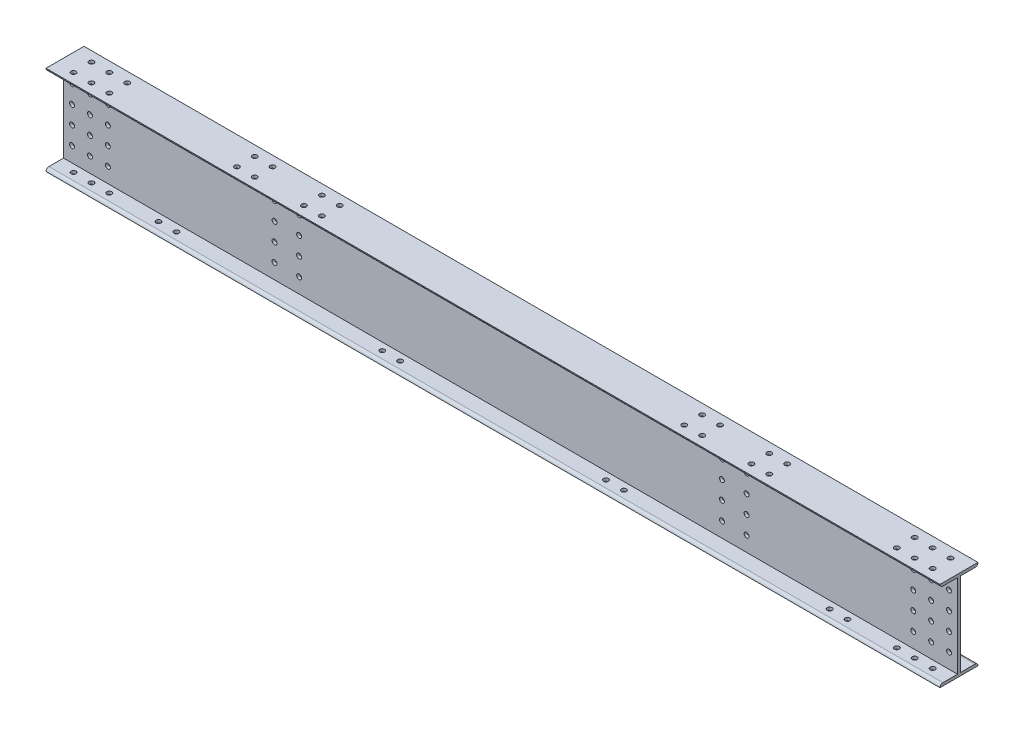
from build123d import *

# Parameters (mm, degrees)
SKETCH_1_W                         = 3996
SKETCH_1_H                         = 400
EXTRUDE_1_DEPTH                    = 170
SKETCH_2_R                         = 11
CUT_EXTRUDE_1_DEPTH                = 4020.566643309
PATTERN_LINEAR_1_COUNT             = 4
PATTERN_LINEAR_1_PITCH             = 80
PATTERN_LINEAR_8_COUNT             = 2
PATTERN_LINEAR_8_PITCH             = 80
PATTERN_LINEAR_8_COPY_1_SKETCH_R   = 11
PATTERN_LINEAR_8_COPY_1_DEPTH      = 4020.566643309
PATTERN_LINEAR_8_COPY_2_SKETCH_R   = 11
PATTERN_LINEAR_8_COPY_2_DEPTH      = 4020.566643309
PATTERN_LINEAR_8_COPY_3_SKETCH_R   = 11
PATTERN_LINEAR_8_COPY_3_DEPTH      = 4020.566643309
PATTERN_LINEAR_9_COUNT             = 2
PATTERN_LINEAR_9_PITCH             = 160
PATTERN_LINEAR_9_COPY_1_SKETCH_R   = 11
PATTERN_LINEAR_9_COPY_1_DEPTH      = 4020.566643309
PATTERN_LINEAR_9_COPY_2_SKETCH_R   = 11
PATTERN_LINEAR_9_COPY_2_DEPTH      = 4020.566643309
PATTERN_LINEAR_9_COPY_3_SKETCH_R   = 11
PATTERN_LINEAR_9_COPY_3_DEPTH      = 4020.566643309
PATTERN_LINEAR_11_COUNT            = 2
PATTERN_LINEAR_11_PITCH            = 3760
PATTERN_LINEAR_11_COPY_1_SKETCH_R  = 11
PATTERN_LINEAR_11_COPY_1_DEPTH     = 4020.566643309
PATTERN_LINEAR_11_COPY_2_SKETCH_R  = 11
PATTERN_LINEAR_11_COPY_2_DEPTH     = 4020.566643309
PATTERN_LINEAR_11_COPY_3_SKETCH_R  = 11
PATTERN_LINEAR_11_COPY_3_DEPTH     = 4020.566643309
PATTERN_LINEAR_11_COPY_4_SKETCH_R  = 11
PATTERN_LINEAR_11_COPY_4_DEPTH     = 4020.566643309
PATTERN_LINEAR_11_COPY_5_SKETCH_R  = 11
PATTERN_LINEAR_11_COPY_5_DEPTH     = 4020.566643309
PATTERN_LINEAR_11_COPY_6_SKETCH_R  = 11
PATTERN_LINEAR_11_COPY_6_DEPTH     = 4020.566643309
PATTERN_LINEAR_11_COPY_7_SKETCH_R  = 11
PATTERN_LINEAR_11_COPY_7_DEPTH     = 4020.566643309
PATTERN_LINEAR_11_COPY_8_SKETCH_R  = 11
PATTERN_LINEAR_11_COPY_8_DEPTH     = 4020.566643309
PATTERN_LINEAR_11_COPY_9_SKETCH_R  = 11
PATTERN_LINEAR_11_COPY_9_DEPTH     = 4020.566643309
PATTERN_LINEAR_11_COPY_10_SKETCH_R = 11
PATTERN_LINEAR_11_COPY_10_DEPTH    = 4020.566643309
PATTERN_LINEAR_11_COPY_11_SKETCH_R = 11
PATTERN_LINEAR_11_COPY_11_DEPTH    = 4020.566643309
PATTERN_LINEAR_12_COUNT            = 2
PATTERN_LINEAR_12_PITCH            = 905
PATTERN_LINEAR_12_COPY_1_SKETCH_R  = 11
PATTERN_LINEAR_12_COPY_1_DEPTH     = 4020.566643309
PATTERN_LINEAR_12_COPY_2_SKETCH_R  = 11
PATTERN_LINEAR_12_COPY_2_DEPTH     = 4020.566643309
PATTERN_LINEAR_12_COPY_3_SKETCH_R  = 11
PATTERN_LINEAR_12_COPY_3_DEPTH     = 4020.566643309
PATTERN_LINEAR_13_COUNT            = 2
PATTERN_LINEAR_13_PITCH            = 1015
PATTERN_LINEAR_13_COPY_1_SKETCH_R  = 11
PATTERN_LINEAR_13_COPY_1_DEPTH     = 4020.566643309
PATTERN_LINEAR_13_COPY_2_SKETCH_R  = 11
PATTERN_LINEAR_13_COPY_2_DEPTH     = 4020.566643309
PATTERN_LINEAR_13_COPY_3_SKETCH_R  = 11
PATTERN_LINEAR_13_COPY_3_DEPTH     = 4020.566643309
PATTERN_LINEAR_15_COUNT            = 2
PATTERN_LINEAR_15_PITCH            = 3015
PATTERN_LINEAR_15_COPY_1_SKETCH_R  = 11
PATTERN_LINEAR_15_COPY_1_DEPTH     = 4020.566643309
PATTERN_LINEAR_15_COPY_2_SKETCH_R  = 11
PATTERN_LINEAR_15_COPY_2_DEPTH     = 4020.566643309
PATTERN_LINEAR_15_COPY_3_SKETCH_R  = 11
PATTERN_LINEAR_15_COPY_3_DEPTH     = 4020.566643309
PATTERN_LINEAR_17_COUNT            = 2
PATTERN_LINEAR_17_PITCH            = 2905
PATTERN_LINEAR_17_COPY_1_SKETCH_R  = 11
PATTERN_LINEAR_17_COPY_1_DEPTH     = 4020.566643309
PATTERN_LINEAR_17_COPY_2_SKETCH_R  = 11
PATTERN_LINEAR_17_COPY_2_DEPTH     = 4020.566643309
PATTERN_LINEAR_17_COPY_3_SKETCH_R  = 11
PATTERN_LINEAR_17_COPY_3_DEPTH     = 4020.566643309
SKETCH_3_R                         = 11
CUT_EXTRUDE_2_DEPTH                = 120
PATTERN_LINEAR_18_COUNT            = 2
PATTERN_LINEAR_18_PITCH            = 80
PATTERN_LINEAR_19_COUNT            = 3
PATTERN_LINEAR_19_PITCH            = 80
PATTERN_LINEAR_19_COPY_1_SKETCH_R  = 11
PATTERN_LINEAR_19_COPY_1_DEPTH     = 120
PATTERN_LINEAR_19_COPY_2_SKETCH_R  = 11
PATTERN_LINEAR_19_COPY_2_DEPTH     = 120
PATTERN_LINEAR_20_COUNT            = 2
PATTERN_LINEAR_20_PITCH            = 3680
PATTERN_LINEAR_20_COPY_1_SKETCH_R  = 11
PATTERN_LINEAR_20_COPY_1_DEPTH     = 120
PATTERN_LINEAR_20_COPY_2_SKETCH_R  = 11
PATTERN_LINEAR_20_COPY_2_DEPTH     = 120
PATTERN_LINEAR_20_COPY_3_SKETCH_R  = 11
PATTERN_LINEAR_20_COPY_3_DEPTH     = 120
PATTERN_LINEAR_20_COPY_4_SKETCH_R  = 11
PATTERN_LINEAR_20_COPY_4_DEPTH     = 120
PATTERN_LINEAR_20_COPY_5_SKETCH_R  = 11
PATTERN_LINEAR_20_COPY_5_DEPTH     = 120
PATTERN_LINEAR_21_COUNT            = 2
PATTERN_LINEAR_21_PITCH            = 730
PATTERN_LINEAR_21_COPY_1_SKETCH_R  = 11
PATTERN_LINEAR_21_COPY_1_DEPTH     = 120
PATTERN_LINEAR_22_COUNT            = 2
PATTERN_LINEAR_22_PITCH            = 810
PATTERN_LINEAR_22_COPY_1_SKETCH_R  = 11
PATTERN_LINEAR_22_COPY_1_DEPTH     = 120
PATTERN_LINEAR_24_COUNT            = 2
PATTERN_LINEAR_24_PITCH            = 1030
PATTERN_LINEAR_24_COPY_1_SKETCH_R  = 11
PATTERN_LINEAR_24_COPY_1_DEPTH     = 120
PATTERN_LINEAR_25_COUNT            = 2
PATTERN_LINEAR_25_PITCH            = 1110
PATTERN_LINEAR_25_COPY_1_SKETCH_R  = 11
PATTERN_LINEAR_25_COPY_1_DEPTH     = 120
PATTERN_LINEAR_26_COUNT            = 2
PATTERN_LINEAR_26_PITCH            = 3110
PATTERN_LINEAR_26_COPY_1_SKETCH_R  = 11
PATTERN_LINEAR_26_COPY_1_DEPTH     = 120
PATTERN_LINEAR_27_COUNT            = 2
PATTERN_LINEAR_27_PITCH            = 3030
PATTERN_LINEAR_27_COPY_1_SKETCH_R  = 11
PATTERN_LINEAR_27_COPY_1_DEPTH     = 120
PATTERN_LINEAR_28_COUNT            = 2
PATTERN_LINEAR_28_PITCH            = 2810
PATTERN_LINEAR_28_COPY_1_SKETCH_R  = 11
PATTERN_LINEAR_28_COPY_1_DEPTH     = 120
PATTERN_LINEAR_29_COUNT            = 2
PATTERN_LINEAR_29_PITCH            = 2730
PATTERN_LINEAR_29_COPY_1_SKETCH_R  = 11
PATTERN_LINEAR_29_COPY_1_DEPTH     = 120
CUT_EXTRUDE_START                  = -120
SKETCH_4_R                         = 11
CUT_EXTRUDE_3_DEPTH                = 120
PATTERN_LINEAR_39_COUNT            = 2
PATTERN_LINEAR_39_PITCH            = 80
PATTERN_LINEAR_40_COUNT            = 2
PATTERN_LINEAR_40_PITCH            = 80
PATTERN_START                      = -120
PATTERN_LINEAR_40_COPY_1_SKETCH_R  = 11
PATTERN_LINEAR_40_COPY_1_DEPTH     = 120
PATTERN_LINEAR_41_COUNT            = 2
PATTERN_LINEAR_41_PITCH            = 160
PATTERN_LINEAR_41_COPY_1_SKETCH_R  = 11
PATTERN_LINEAR_41_COPY_1_DEPTH     = 120
PATTERN_LINEAR_43_COUNT            = 2
PATTERN_LINEAR_43_PITCH            = 1380
PATTERN_LINEAR_43_COPY_1_SKETCH_R  = 11
PATTERN_LINEAR_43_COPY_1_DEPTH     = 120
PATTERN_LINEAR_43_COPY_2_SKETCH_R  = 11
PATTERN_LINEAR_43_COPY_2_DEPTH     = 120
PATTERN_LINEAR_43_COPY_3_SKETCH_R  = 11
PATTERN_LINEAR_43_COPY_3_DEPTH     = 120
PATTERN_LINEAR_44_COUNT            = 2
PATTERN_LINEAR_44_PITCH            = 380
PATTERN_LINEAR_44_COPY_1_SKETCH_R  = 11
PATTERN_LINEAR_44_COPY_1_DEPTH     = 120
PATTERN_LINEAR_44_COPY_2_SKETCH_R  = 11
PATTERN_LINEAR_44_COPY_2_DEPTH     = 120
PATTERN_LINEAR_44_COPY_3_SKETCH_R  = 11
PATTERN_LINEAR_44_COPY_3_DEPTH     = 120
PATTERN_LINEAR_46_COUNT            = 2
PATTERN_LINEAR_46_PITCH            = 2380
PATTERN_LINEAR_46_COPY_1_SKETCH_R  = 11
PATTERN_LINEAR_46_COPY_1_DEPTH     = 120
PATTERN_LINEAR_46_COPY_2_SKETCH_R  = 11
PATTERN_LINEAR_46_COPY_2_DEPTH     = 120
PATTERN_LINEAR_46_COPY_3_SKETCH_R  = 11
PATTERN_LINEAR_46_COPY_3_DEPTH     = 120
PATTERN_LINEAR_47_COUNT            = 2
PATTERN_LINEAR_47_PITCH            = 3380
PATTERN_LINEAR_47_COPY_1_SKETCH_R  = 11
PATTERN_LINEAR_47_COPY_1_DEPTH     = 120
PATTERN_LINEAR_47_COPY_2_SKETCH_R  = 11
PATTERN_LINEAR_47_COPY_2_DEPTH     = 120
PATTERN_LINEAR_47_COPY_3_SKETCH_R  = 11
PATTERN_LINEAR_47_COPY_3_DEPTH     = 120
PATTERN_LINEAR_48_COUNT            = 2
PATTERN_LINEAR_48_PITCH            = 3680
PATTERN_LINEAR_48_COPY_1_SKETCH_R  = 11
PATTERN_LINEAR_48_COPY_1_DEPTH     = 120
PATTERN_LINEAR_48_COPY_2_SKETCH_R  = 11
PATTERN_LINEAR_48_COPY_2_DEPTH     = 120
PATTERN_LINEAR_48_COPY_3_SKETCH_R  = 11
PATTERN_LINEAR_48_COPY_3_DEPTH     = 120
PATTERN_LINEAR_48_COPY_4_SKETCH_R  = 11
PATTERN_LINEAR_48_COPY_4_DEPTH     = 120
PATTERN_LINEAR_48_COPY_5_SKETCH_R  = 11
PATTERN_LINEAR_48_COPY_5_DEPTH     = 120
SKETCH_6_W                         = 78.5
SKETCH_6_H                         = 374
CUT_EXTRUDE_4_DEPTH                = 4020.566643309
FILLET_1_R                         = 13
FILLET_2_R                         = 13
FILLET_3_R                         = 13
FILLET_4_R                         = 13


with BuildPart() as part:
    # 草图1 → 拉伸1 (new body)
    with BuildSketch(Plane.XY):
        with Locations((1998, 200)):
            Rectangle(SKETCH_1_W, SKETCH_1_H)
    extrude(amount=EXTRUDE_1_DEPTH)

    # 草图2 → 切除-拉伸1 (cut, through all)
    with BuildSketch(Plane.XY.offset(170)):
        with Locations((38, 80)):
            Circle(SKETCH_2_R)
    cut_extrude_1 = extrude(amount=-CUT_EXTRUDE_1_DEPTH, mode=Mode.SUBTRACT)

    # 阵列(线性)1: 切除-拉伸1 ×4
    with Locations(*[(0, i * PATTERN_LINEAR_1_PITCH, 0) for i in range(1, PATTERN_LINEAR_1_COUNT)]):
        add(cut_extrude_1, mode=Mode.SUBTRACT)

    # 阵列(线性)8: 切除-拉伸1 ×2
    with Locations(*[(i * PATTERN_LINEAR_8_PITCH, 0, 0) for i in range(1, PATTERN_LINEAR_8_COUNT)]):
        add(cut_extrude_1, mode=Mode.SUBTRACT)

    # 阵列(线性)8 copy 1 sketch → 阵列(线性)8 copy 1 (cut, through all)
    with BuildSketch(Plane(origin=(80, 80, 170), x_dir=(1, 0, 0), z_dir=(0, 0, 1))):
        with Locations((38, 80)):
            Circle(PATTERN_LINEAR_8_COPY_1_SKETCH_R)
    extrude(amount=-PATTERN_LINEAR_8_COPY_1_DEPTH, mode=Mode.SUBTRACT)

    # 阵列(线性)8 copy 2 sketch → 阵列(线性)8 copy 2 (cut, through all)
    with BuildSketch(Plane(origin=(80, 160, 170), x_dir=(1, 0, 0), z_dir=(0, 0, 1))):
        with Locations((38, 80)):
            Circle(PATTERN_LINEAR_8_COPY_2_SKETCH_R)
    extrude(amount=-PATTERN_LINEAR_8_COPY_2_DEPTH, mode=Mode.SUBTRACT)

    # 阵列(线性)8 copy 3 sketch → 阵列(线性)8 copy 3 (cut, through all)
    with BuildSketch(Plane(origin=(80, 240, 170), x_dir=(1, 0, 0), z_dir=(0, 0, 1))):
        with Locations((38, 80)):
            Circle(PATTERN_LINEAR_8_COPY_3_SKETCH_R)
    extrude(amount=-PATTERN_LINEAR_8_COPY_3_DEPTH, mode=Mode.SUBTRACT)

    # 阵列(线性)9: 切除-拉伸1 ×2
    with Locations(*[(i * PATTERN_LINEAR_9_PITCH, 0, 0) for i in range(1, PATTERN_LINEAR_9_COUNT)]):
        add(cut_extrude_1, mode=Mode.SUBTRACT)

    # 阵列(线性)9 copy 1 sketch → 阵列(线性)9 copy 1 (cut, through all)
    with BuildSketch(Plane(origin=(160, 80, 170), x_dir=(1, 0, 0), z_dir=(0, 0, 1))):
        with Locations((38, 80)):
            Circle(PATTERN_LINEAR_9_COPY_1_SKETCH_R)
    extrude(amount=-PATTERN_LINEAR_9_COPY_1_DEPTH, mode=Mode.SUBTRACT)

    # 阵列(线性)9 copy 2 sketch → 阵列(线性)9 copy 2 (cut, through all)
    with BuildSketch(Plane(origin=(160, 160, 170), x_dir=(1, 0, 0), z_dir=(0, 0, 1))):
        with Locations((38, 80)):
            Circle(PATTERN_LINEAR_9_COPY_2_SKETCH_R)
    extrude(amount=-PATTERN_LINEAR_9_COPY_2_DEPTH, mode=Mode.SUBTRACT)

    # 阵列(线性)9 copy 3 sketch → 阵列(线性)9 copy 3 (cut, through all)
    with BuildSketch(Plane(origin=(160, 240, 170), x_dir=(1, 0, 0), z_dir=(0, 0, 1))):
        with Locations((38, 80)):
            Circle(PATTERN_LINEAR_9_COPY_3_SKETCH_R)
    extrude(amount=-PATTERN_LINEAR_9_COPY_3_DEPTH, mode=Mode.SUBTRACT)

    # 阵列(线性)11: 切除-拉伸1 ×2
    with Locations(*[(i * PATTERN_LINEAR_11_PITCH, 0, 0) for i in range(1, PATTERN_LINEAR_11_COUNT)]):
        add(cut_extrude_1, mode=Mode.SUBTRACT)

    # 阵列(线性)11 copy 1 sketch → 阵列(线性)11 copy 1 (cut, through all)
    with BuildSketch(Plane(origin=(3760, 80, 170), x_dir=(1, 0, 0), z_dir=(0, 0, 1))):
        with Locations((38, 80)):
            Circle(PATTERN_LINEAR_11_COPY_1_SKETCH_R)
    extrude(amount=-PATTERN_LINEAR_11_COPY_1_DEPTH, mode=Mode.SUBTRACT)

    # 阵列(线性)11 copy 2 sketch → 阵列(线性)11 copy 2 (cut, through all)
    with BuildSketch(Plane(origin=(3760, 160, 170), x_dir=(1, 0, 0), z_dir=(0, 0, 1))):
        with Locations((38, 80)):
            Circle(PATTERN_LINEAR_11_COPY_2_SKETCH_R)
    extrude(amount=-PATTERN_LINEAR_11_COPY_2_DEPTH, mode=Mode.SUBTRACT)

    # 阵列(线性)11 copy 3 sketch → 阵列(线性)11 copy 3 (cut, through all)
    with BuildSketch(Plane(origin=(3760, 240, 170), x_dir=(1, 0, 0), z_dir=(0, 0, 1))):
        with Locations((38, 80)):
            Circle(PATTERN_LINEAR_11_COPY_3_SKETCH_R)
    extrude(amount=-PATTERN_LINEAR_11_COPY_3_DEPTH, mode=Mode.SUBTRACT)

    # 阵列(线性)11 copy 4 sketch → 阵列(线性)11 copy 4 (cut, through all)
    with BuildSketch(Plane(origin=(3840, 0, 170), x_dir=(1, 0, 0), z_dir=(0, 0, 1))):
        with Locations((38, 80)):
            Circle(PATTERN_LINEAR_11_COPY_4_SKETCH_R)
    extrude(amount=-PATTERN_LINEAR_11_COPY_4_DEPTH, mode=Mode.SUBTRACT)

    # 阵列(线性)11 copy 5 sketch → 阵列(线性)11 copy 5 (cut, through all)
    with BuildSketch(Plane(origin=(3840, 80, 170), x_dir=(1, 0, 0), z_dir=(0, 0, 1))):
        with Locations((38, 80)):
            Circle(PATTERN_LINEAR_11_COPY_5_SKETCH_R)
    extrude(amount=-PATTERN_LINEAR_11_COPY_5_DEPTH, mode=Mode.SUBTRACT)

    # 阵列(线性)11 copy 6 sketch → 阵列(线性)11 copy 6 (cut, through all)
    with BuildSketch(Plane(origin=(3840, 160, 170), x_dir=(1, 0, 0), z_dir=(0, 0, 1))):
        with Locations((38, 80)):
            Circle(PATTERN_LINEAR_11_COPY_6_SKETCH_R)
    extrude(amount=-PATTERN_LINEAR_11_COPY_6_DEPTH, mode=Mode.SUBTRACT)

    # 阵列(线性)11 copy 7 sketch → 阵列(线性)11 copy 7 (cut, through all)
    with BuildSketch(Plane(origin=(3840, 240, 170), x_dir=(1, 0, 0), z_dir=(0, 0, 1))):
        with Locations((38, 80)):
            Circle(PATTERN_LINEAR_11_COPY_7_SKETCH_R)
    extrude(amount=-PATTERN_LINEAR_11_COPY_7_DEPTH, mode=Mode.SUBTRACT)

    # 阵列(线性)11 copy 8 sketch → 阵列(线性)11 copy 8 (cut, through all)
    with BuildSketch(Plane(origin=(3920, 0, 170), x_dir=(1, 0, 0), z_dir=(0, 0, 1))):
        with Locations((38, 80)):
            Circle(PATTERN_LINEAR_11_COPY_8_SKETCH_R)
    extrude(amount=-PATTERN_LINEAR_11_COPY_8_DEPTH, mode=Mode.SUBTRACT)

    # 阵列(线性)11 copy 9 sketch → 阵列(线性)11 copy 9 (cut, through all)
    with BuildSketch(Plane(origin=(3920, 80, 170), x_dir=(1, 0, 0), z_dir=(0, 0, 1))):
        with Locations((38, 80)):
            Circle(PATTERN_LINEAR_11_COPY_9_SKETCH_R)
    extrude(amount=-PATTERN_LINEAR_11_COPY_9_DEPTH, mode=Mode.SUBTRACT)

    # 阵列(线性)11 copy 10 sketch → 阵列(线性)11 copy 10 (cut, through all)
    with BuildSketch(Plane(origin=(3920, 160, 170), x_dir=(1, 0, 0), z_dir=(0, 0, 1))):
        with Locations((38, 80)):
            Circle(PATTERN_LINEAR_11_COPY_10_SKETCH_R)
    extrude(amount=-PATTERN_LINEAR_11_COPY_10_DEPTH, mode=Mode.SUBTRACT)

    # 阵列(线性)11 copy 11 sketch → 阵列(线性)11 copy 11 (cut, through all)
    with BuildSketch(Plane(origin=(3920, 240, 170), x_dir=(1, 0, 0), z_dir=(0, 0, 1))):
        with Locations((38, 80)):
            Circle(PATTERN_LINEAR_11_COPY_11_SKETCH_R)
    extrude(amount=-PATTERN_LINEAR_11_COPY_11_DEPTH, mode=Mode.SUBTRACT)

    # 阵列(线性)12: 切除-拉伸1 ×2
    with Locations(*[(i * PATTERN_LINEAR_12_PITCH, 0, 0) for i in range(1, PATTERN_LINEAR_12_COUNT)]):
        add(cut_extrude_1, mode=Mode.SUBTRACT)

    # 阵列(线性)12 copy 1 sketch → 阵列(线性)12 copy 1 (cut, through all)
    with BuildSketch(Plane(origin=(905, 80, 170), x_dir=(1, 0, 0), z_dir=(0, 0, 1))):
        with Locations((38, 80)):
            Circle(PATTERN_LINEAR_12_COPY_1_SKETCH_R)
    extrude(amount=-PATTERN_LINEAR_12_COPY_1_DEPTH, mode=Mode.SUBTRACT)

    # 阵列(线性)12 copy 2 sketch → 阵列(线性)12 copy 2 (cut, through all)
    with BuildSketch(Plane(origin=(905, 160, 170), x_dir=(1, 0, 0), z_dir=(0, 0, 1))):
        with Locations((38, 80)):
            Circle(PATTERN_LINEAR_12_COPY_2_SKETCH_R)
    extrude(amount=-PATTERN_LINEAR_12_COPY_2_DEPTH, mode=Mode.SUBTRACT)

    # 阵列(线性)12 copy 3 sketch → 阵列(线性)12 copy 3 (cut, through all)
    with BuildSketch(Plane(origin=(905, 240, 170), x_dir=(1, 0, 0), z_dir=(0, 0, 1))):
        with Locations((38, 80)):
            Circle(PATTERN_LINEAR_12_COPY_3_SKETCH_R)
    extrude(amount=-PATTERN_LINEAR_12_COPY_3_DEPTH, mode=Mode.SUBTRACT)

    # 阵列(线性)13: 切除-拉伸1 ×2
    with Locations(*[(i * PATTERN_LINEAR_13_PITCH, 0, 0) for i in range(1, PATTERN_LINEAR_13_COUNT)]):
        add(cut_extrude_1, mode=Mode.SUBTRACT)

    # 阵列(线性)13 copy 1 sketch → 阵列(线性)13 copy 1 (cut, through all)
    with BuildSketch(Plane(origin=(1015, 80, 170), x_dir=(1, 0, 0), z_dir=(0, 0, 1))):
        with Locations((38, 80)):
            Circle(PATTERN_LINEAR_13_COPY_1_SKETCH_R)
    extrude(amount=-PATTERN_LINEAR_13_COPY_1_DEPTH, mode=Mode.SUBTRACT)

    # 阵列(线性)13 copy 2 sketch → 阵列(线性)13 copy 2 (cut, through all)
    with BuildSketch(Plane(origin=(1015, 160, 170), x_dir=(1, 0, 0), z_dir=(0, 0, 1))):
        with Locations((38, 80)):
            Circle(PATTERN_LINEAR_13_COPY_2_SKETCH_R)
    extrude(amount=-PATTERN_LINEAR_13_COPY_2_DEPTH, mode=Mode.SUBTRACT)

    # 阵列(线性)13 copy 3 sketch → 阵列(线性)13 copy 3 (cut, through all)
    with BuildSketch(Plane(origin=(1015, 240, 170), x_dir=(1, 0, 0), z_dir=(0, 0, 1))):
        with Locations((38, 80)):
            Circle(PATTERN_LINEAR_13_COPY_3_SKETCH_R)
    extrude(amount=-PATTERN_LINEAR_13_COPY_3_DEPTH, mode=Mode.SUBTRACT)

    # 阵列(线性)15: 切除-拉伸1 ×2
    with Locations(*[(i * PATTERN_LINEAR_15_PITCH, 0, 0) for i in range(1, PATTERN_LINEAR_15_COUNT)]):
        add(cut_extrude_1, mode=Mode.SUBTRACT)

    # 阵列(线性)15 copy 1 sketch → 阵列(线性)15 copy 1 (cut, through all)
    with BuildSketch(Plane(origin=(3015, 80, 170), x_dir=(1, 0, 0), z_dir=(0, 0, 1))):
        with Locations((38, 80)):
            Circle(PATTERN_LINEAR_15_COPY_1_SKETCH_R)
    extrude(amount=-PATTERN_LINEAR_15_COPY_1_DEPTH, mode=Mode.SUBTRACT)

    # 阵列(线性)15 copy 2 sketch → 阵列(线性)15 copy 2 (cut, through all)
    with BuildSketch(Plane(origin=(3015, 160, 170), x_dir=(1, 0, 0), z_dir=(0, 0, 1))):
        with Locations((38, 80)):
            Circle(PATTERN_LINEAR_15_COPY_2_SKETCH_R)
    extrude(amount=-PATTERN_LINEAR_15_COPY_2_DEPTH, mode=Mode.SUBTRACT)

    # 阵列(线性)15 copy 3 sketch → 阵列(线性)15 copy 3 (cut, through all)
    with BuildSketch(Plane(origin=(3015, 240, 170), x_dir=(1, 0, 0), z_dir=(0, 0, 1))):
        with Locations((38, 80)):
            Circle(PATTERN_LINEAR_15_COPY_3_SKETCH_R)
    extrude(amount=-PATTERN_LINEAR_15_COPY_3_DEPTH, mode=Mode.SUBTRACT)

    # 阵列(线性)17: 切除-拉伸1 ×2
    with Locations(*[(i * PATTERN_LINEAR_17_PITCH, 0, 0) for i in range(1, PATTERN_LINEAR_17_COUNT)]):
        add(cut_extrude_1, mode=Mode.SUBTRACT)

    # 阵列(线性)17 copy 1 sketch → 阵列(线性)17 copy 1 (cut, through all)
    with BuildSketch(Plane(origin=(2905, 80, 170), x_dir=(1, 0, 0), z_dir=(0, 0, 1))):
        with Locations((38, 80)):
            Circle(PATTERN_LINEAR_17_COPY_1_SKETCH_R)
    extrude(amount=-PATTERN_LINEAR_17_COPY_1_DEPTH, mode=Mode.SUBTRACT)

    # 阵列(线性)17 copy 2 sketch → 阵列(线性)17 copy 2 (cut, through all)
    with BuildSketch(Plane(origin=(2905, 160, 170), x_dir=(1, 0, 0), z_dir=(0, 0, 1))):
        with Locations((38, 80)):
            Circle(PATTERN_LINEAR_17_COPY_2_SKETCH_R)
    extrude(amount=-PATTERN_LINEAR_17_COPY_2_DEPTH, mode=Mode.SUBTRACT)

    # 阵列(线性)17 copy 3 sketch → 阵列(线性)17 copy 3 (cut, through all)
    with BuildSketch(Plane(origin=(2905, 240, 170), x_dir=(1, 0, 0), z_dir=(0, 0, 1))):
        with Locations((38, 80)):
            Circle(PATTERN_LINEAR_17_COPY_3_SKETCH_R)
    extrude(amount=-PATTERN_LINEAR_17_COPY_3_DEPTH, mode=Mode.SUBTRACT)

    # 草图3 → 切除-拉伸2 (cut)
    with BuildSketch(Plane(origin=(0, 400, 0), x_dir=(1, 0, 0), z_dir=(0, 1, 0))):
        with Locations(Location((78, -125, 0), (0, 0, 270))):
            Circle(SKETCH_3_R)
    cut_extrude_2 = extrude(amount=-CUT_EXTRUDE_2_DEPTH, mode=Mode.SUBTRACT)

    # 阵列(线性)18: 切除-拉伸2 ×2
    with Locations(*[(0, 0, -i * PATTERN_LINEAR_18_PITCH) for i in range(1, PATTERN_LINEAR_18_COUNT)]):
        add(cut_extrude_2, mode=Mode.SUBTRACT)

    # 阵列(线性)19: 切除-拉伸2 ×3
    with Locations(*[(i * PATTERN_LINEAR_19_PITCH, 0, 0) for i in range(1, PATTERN_LINEAR_19_COUNT)]):
        add(cut_extrude_2, mode=Mode.SUBTRACT)

    # 阵列(线性)19 copy 1 sketch → 阵列(线性)19 copy 1 (cut)
    with BuildSketch(Plane(origin=(80, 400, -80), x_dir=(1, 0, 0), z_dir=(0, 1, 0))):
        with Locations(Location((78, -125, 0), (0, 0, 270))):
            Circle(PATTERN_LINEAR_19_COPY_1_SKETCH_R)
    extrude(amount=-PATTERN_LINEAR_19_COPY_1_DEPTH, mode=Mode.SUBTRACT)

    # 阵列(线性)19 copy 2 sketch → 阵列(线性)19 copy 2 (cut)
    with BuildSketch(Plane(origin=(160, 400, -80), x_dir=(1, 0, 0), z_dir=(0, 1, 0))):
        with Locations(Location((78, -125, 0), (0, 0, 270))):
            Circle(PATTERN_LINEAR_19_COPY_2_SKETCH_R)
    extrude(amount=-PATTERN_LINEAR_19_COPY_2_DEPTH, mode=Mode.SUBTRACT)

    # 阵列(线性)20: 切除-拉伸2 ×2
    with Locations(*[(i * PATTERN_LINEAR_20_PITCH, 0, 0) for i in range(1, PATTERN_LINEAR_20_COUNT)]):
        add(cut_extrude_2, mode=Mode.SUBTRACT)

    # 阵列(线性)20 copy 1 sketch → 阵列(线性)20 copy 1 (cut)
    with BuildSketch(Plane(origin=(3680, 400, -80), x_dir=(1, 0, 0), z_dir=(0, 1, 0))):
        with Locations(Location((78, -125, 0), (0, 0, 270))):
            Circle(PATTERN_LINEAR_20_COPY_1_SKETCH_R)
    extrude(amount=-PATTERN_LINEAR_20_COPY_1_DEPTH, mode=Mode.SUBTRACT)

    # 阵列(线性)20 copy 2 sketch → 阵列(线性)20 copy 2 (cut)
    with BuildSketch(Plane(origin=(3760, 400, 0), x_dir=(1, 0, 0), z_dir=(0, 1, 0))):
        with Locations(Location((78, -125, 0), (0, 0, 270))):
            Circle(PATTERN_LINEAR_20_COPY_2_SKETCH_R)
    extrude(amount=-PATTERN_LINEAR_20_COPY_2_DEPTH, mode=Mode.SUBTRACT)

    # 阵列(线性)20 copy 3 sketch → 阵列(线性)20 copy 3 (cut)
    with BuildSketch(Plane(origin=(3840, 400, 0), x_dir=(1, 0, 0), z_dir=(0, 1, 0))):
        with Locations(Location((78, -125, 0), (0, 0, 270))):
            Circle(PATTERN_LINEAR_20_COPY_3_SKETCH_R)
    extrude(amount=-PATTERN_LINEAR_20_COPY_3_DEPTH, mode=Mode.SUBTRACT)

    # 阵列(线性)20 copy 4 sketch → 阵列(线性)20 copy 4 (cut)
    with BuildSketch(Plane(origin=(3760, 400, -80), x_dir=(1, 0, 0), z_dir=(0, 1, 0))):
        with Locations(Location((78, -125, 0), (0, 0, 270))):
            Circle(PATTERN_LINEAR_20_COPY_4_SKETCH_R)
    extrude(amount=-PATTERN_LINEAR_20_COPY_4_DEPTH, mode=Mode.SUBTRACT)

    # 阵列(线性)20 copy 5 sketch → 阵列(线性)20 copy 5 (cut)
    with BuildSketch(Plane(origin=(3840, 400, -80), x_dir=(1, 0, 0), z_dir=(0, 1, 0))):
        with Locations(Location((78, -125, 0), (0, 0, 270))):
            Circle(PATTERN_LINEAR_20_COPY_5_SKETCH_R)
    extrude(amount=-PATTERN_LINEAR_20_COPY_5_DEPTH, mode=Mode.SUBTRACT)

    # 阵列(线性)21: 切除-拉伸2 ×2
    with Locations(*[(i * PATTERN_LINEAR_21_PITCH, 0, 0) for i in range(1, PATTERN_LINEAR_21_COUNT)]):
        add(cut_extrude_2, mode=Mode.SUBTRACT)

    # 阵列(线性)21 copy 1 sketch → 阵列(线性)21 copy 1 (cut)
    with BuildSketch(Plane(origin=(730, 400, -80), x_dir=(1, 0, 0), z_dir=(0, 1, 0))):
        with Locations(Location((78, -125, 0), (0, 0, 270))):
            Circle(PATTERN_LINEAR_21_COPY_1_SKETCH_R)
    extrude(amount=-PATTERN_LINEAR_21_COPY_1_DEPTH, mode=Mode.SUBTRACT)

    # 阵列(线性)22: 切除-拉伸2 ×2
    with Locations(*[(i * PATTERN_LINEAR_22_PITCH, 0, 0) for i in range(1, PATTERN_LINEAR_22_COUNT)]):
        add(cut_extrude_2, mode=Mode.SUBTRACT)

    # 阵列(线性)22 copy 1 sketch → 阵列(线性)22 copy 1 (cut)
    with BuildSketch(Plane(origin=(810, 400, -80), x_dir=(1, 0, 0), z_dir=(0, 1, 0))):
        with Locations(Location((78, -125, 0), (0, 0, 270))):
            Circle(PATTERN_LINEAR_22_COPY_1_SKETCH_R)
    extrude(amount=-PATTERN_LINEAR_22_COPY_1_DEPTH, mode=Mode.SUBTRACT)

    # 阵列(线性)24: 切除-拉伸2 ×2
    with Locations(*[(i * PATTERN_LINEAR_24_PITCH, 0, 0) for i in range(1, PATTERN_LINEAR_24_COUNT)]):
        add(cut_extrude_2, mode=Mode.SUBTRACT)

    # 阵列(线性)24 copy 1 sketch → 阵列(线性)24 copy 1 (cut)
    with BuildSketch(Plane(origin=(1030, 400, -80), x_dir=(1, 0, 0), z_dir=(0, 1, 0))):
        with Locations(Location((78, -125, 0), (0, 0, 270))):
            Circle(PATTERN_LINEAR_24_COPY_1_SKETCH_R)
    extrude(amount=-PATTERN_LINEAR_24_COPY_1_DEPTH, mode=Mode.SUBTRACT)

    # 阵列(线性)25: 切除-拉伸2 ×2
    with Locations(*[(i * PATTERN_LINEAR_25_PITCH, 0, 0) for i in range(1, PATTERN_LINEAR_25_COUNT)]):
        add(cut_extrude_2, mode=Mode.SUBTRACT)

    # 阵列(线性)25 copy 1 sketch → 阵列(线性)25 copy 1 (cut)
    with BuildSketch(Plane(origin=(1110, 400, -80), x_dir=(1, 0, 0), z_dir=(0, 1, 0))):
        with Locations(Location((78, -125, 0), (0, 0, 270))):
            Circle(PATTERN_LINEAR_25_COPY_1_SKETCH_R)
    extrude(amount=-PATTERN_LINEAR_25_COPY_1_DEPTH, mode=Mode.SUBTRACT)

    # 阵列(线性)26: 切除-拉伸2 ×2
    with Locations(*[(i * PATTERN_LINEAR_26_PITCH, 0, 0) for i in range(1, PATTERN_LINEAR_26_COUNT)]):
        add(cut_extrude_2, mode=Mode.SUBTRACT)

    # 阵列(线性)26 copy 1 sketch → 阵列(线性)26 copy 1 (cut)
    with BuildSketch(Plane(origin=(3110, 400, -80), x_dir=(1, 0, 0), z_dir=(0, 1, 0))):
        with Locations(Location((78, -125, 0), (0, 0, 270))):
            Circle(PATTERN_LINEAR_26_COPY_1_SKETCH_R)
    extrude(amount=-PATTERN_LINEAR_26_COPY_1_DEPTH, mode=Mode.SUBTRACT)

    # 阵列(线性)27: 切除-拉伸2 ×2
    with Locations(*[(i * PATTERN_LINEAR_27_PITCH, 0, 0) for i in range(1, PATTERN_LINEAR_27_COUNT)]):
        add(cut_extrude_2, mode=Mode.SUBTRACT)

    # 阵列(线性)27 copy 1 sketch → 阵列(线性)27 copy 1 (cut)
    with BuildSketch(Plane(origin=(3030, 400, -80), x_dir=(1, 0, 0), z_dir=(0, 1, 0))):
        with Locations(Location((78, -125, 0), (0, 0, 270))):
            Circle(PATTERN_LINEAR_27_COPY_1_SKETCH_R)
    extrude(amount=-PATTERN_LINEAR_27_COPY_1_DEPTH, mode=Mode.SUBTRACT)

    # 阵列(线性)28: 切除-拉伸2 ×2
    with Locations(*[(i * PATTERN_LINEAR_28_PITCH, 0, 0) for i in range(1, PATTERN_LINEAR_28_COUNT)]):
        add(cut_extrude_2, mode=Mode.SUBTRACT)

    # 阵列(线性)28 copy 1 sketch → 阵列(线性)28 copy 1 (cut)
    with BuildSketch(Plane(origin=(2810, 400, -80), x_dir=(1, 0, 0), z_dir=(0, 1, 0))):
        with Locations(Location((78, -125, 0), (0, 0, 270))):
            Circle(PATTERN_LINEAR_28_COPY_1_SKETCH_R)
    extrude(amount=-PATTERN_LINEAR_28_COPY_1_DEPTH, mode=Mode.SUBTRACT)

    # 阵列(线性)29: 切除-拉伸2 ×2
    with Locations(*[(i * PATTERN_LINEAR_29_PITCH, 0, 0) for i in range(1, PATTERN_LINEAR_29_COUNT)]):
        add(cut_extrude_2, mode=Mode.SUBTRACT)

    # 阵列(线性)29 copy 1 sketch → 阵列(线性)29 copy 1 (cut)
    with BuildSketch(Plane(origin=(2730, 400, -80), x_dir=(1, 0, 0), z_dir=(0, 1, 0))):
        with Locations(Location((78, -125, 0), (0, 0, 270))):
            Circle(PATTERN_LINEAR_29_COPY_1_SKETCH_R)
    extrude(amount=-PATTERN_LINEAR_29_COPY_1_DEPTH, mode=Mode.SUBTRACT)

    # 草图4 → 切除-拉伸3 (cut)
    with BuildSketch(Plane.XZ.offset(CUT_EXTRUDE_START)):
        with Locations(Location((78, 45, 0), (0, 0, 90))):
            Circle(SKETCH_4_R)
    cut_extrude_3 = extrude(amount=CUT_EXTRUDE_3_DEPTH, mode=Mode.SUBTRACT)

    # 阵列(线性)39: 切除-拉伸3 ×2
    with Locations(*[(0, 0, i * PATTERN_LINEAR_39_PITCH) for i in range(1, PATTERN_LINEAR_39_COUNT)]):
        add(cut_extrude_3, mode=Mode.SUBTRACT)

    # 阵列(线性)40: 切除-拉伸3 ×2
    with Locations(*[(i * PATTERN_LINEAR_40_PITCH, 0, 0) for i in range(1, PATTERN_LINEAR_40_COUNT)]):
        add(cut_extrude_3, mode=Mode.SUBTRACT)

    # 阵列(线性)40 copy 1 sketch → 阵列(线性)40 copy 1 (cut)
    with BuildSketch(Plane(origin=(80, 0, 80), x_dir=(1, 0, 0), z_dir=(0, -1, 0)).offset(PATTERN_START)):
        with Locations(Location((78, 45, 0), (0, 0, 90))):
            Circle(PATTERN_LINEAR_40_COPY_1_SKETCH_R)
    extrude(amount=PATTERN_LINEAR_40_COPY_1_DEPTH, mode=Mode.SUBTRACT)

    # 阵列(线性)41: 切除-拉伸3 ×2
    with Locations(*[(i * PATTERN_LINEAR_41_PITCH, 0, 0) for i in range(1, PATTERN_LINEAR_41_COUNT)]):
        add(cut_extrude_3, mode=Mode.SUBTRACT)

    # 阵列(线性)41 copy 1 sketch → 阵列(线性)41 copy 1 (cut)
    with BuildSketch(Plane(origin=(160, 0, 80), x_dir=(1, 0, 0), z_dir=(0, -1, 0)).offset(PATTERN_START)):
        with Locations(Location((78, 45, 0), (0, 0, 90))):
            Circle(PATTERN_LINEAR_41_COPY_1_SKETCH_R)
    extrude(amount=PATTERN_LINEAR_41_COPY_1_DEPTH, mode=Mode.SUBTRACT)

    # 阵列(线性)43: 切除-拉伸3 ×2
    with Locations(*[(i * PATTERN_LINEAR_43_PITCH, 0, 0) for i in range(1, PATTERN_LINEAR_43_COUNT)]):
        add(cut_extrude_3, mode=Mode.SUBTRACT)

    # 阵列(线性)43 copy 1 sketch → 阵列(线性)43 copy 1 (cut)
    with BuildSketch(Plane(origin=(1380, 0, 80), x_dir=(1, 0, 0), z_dir=(0, -1, 0)).offset(PATTERN_START)):
        with Locations(Location((78, 45, 0), (0, 0, 90))):
            Circle(PATTERN_LINEAR_43_COPY_1_SKETCH_R)
    extrude(amount=PATTERN_LINEAR_43_COPY_1_DEPTH, mode=Mode.SUBTRACT)

    # 阵列(线性)43 copy 2 sketch → 阵列(线性)43 copy 2 (cut)
    with BuildSketch(Plane(origin=(1460, 0, 0), x_dir=(1, 0, 0), z_dir=(0, -1, 0)).offset(PATTERN_START)):
        with Locations(Location((78, 45, 0), (0, 0, 90))):
            Circle(PATTERN_LINEAR_43_COPY_2_SKETCH_R)
    extrude(amount=PATTERN_LINEAR_43_COPY_2_DEPTH, mode=Mode.SUBTRACT)

    # 阵列(线性)43 copy 3 sketch → 阵列(线性)43 copy 3 (cut)
    with BuildSketch(Plane(origin=(1460, 0, 80), x_dir=(1, 0, 0), z_dir=(0, -1, 0)).offset(PATTERN_START)):
        with Locations(Location((78, 45, 0), (0, 0, 90))):
            Circle(PATTERN_LINEAR_43_COPY_3_SKETCH_R)
    extrude(amount=PATTERN_LINEAR_43_COPY_3_DEPTH, mode=Mode.SUBTRACT)

    # 阵列(线性)44: 切除-拉伸3 ×2
    with Locations(*[(i * PATTERN_LINEAR_44_PITCH, 0, 0) for i in range(1, PATTERN_LINEAR_44_COUNT)]):
        add(cut_extrude_3, mode=Mode.SUBTRACT)

    # 阵列(线性)44 copy 1 sketch → 阵列(线性)44 copy 1 (cut)
    with BuildSketch(Plane(origin=(380, 0, 80), x_dir=(1, 0, 0), z_dir=(0, -1, 0)).offset(PATTERN_START)):
        with Locations(Location((78, 45, 0), (0, 0, 90))):
            Circle(PATTERN_LINEAR_44_COPY_1_SKETCH_R)
    extrude(amount=PATTERN_LINEAR_44_COPY_1_DEPTH, mode=Mode.SUBTRACT)

    # 阵列(线性)44 copy 2 sketch → 阵列(线性)44 copy 2 (cut)
    with BuildSketch(Plane(origin=(460, 0, 0), x_dir=(1, 0, 0), z_dir=(0, -1, 0)).offset(PATTERN_START)):
        with Locations(Location((78, 45, 0), (0, 0, 90))):
            Circle(PATTERN_LINEAR_44_COPY_2_SKETCH_R)
    extrude(amount=PATTERN_LINEAR_44_COPY_2_DEPTH, mode=Mode.SUBTRACT)

    # 阵列(线性)44 copy 3 sketch → 阵列(线性)44 copy 3 (cut)
    with BuildSketch(Plane(origin=(460, 0, 80), x_dir=(1, 0, 0), z_dir=(0, -1, 0)).offset(PATTERN_START)):
        with Locations(Location((78, 45, 0), (0, 0, 90))):
            Circle(PATTERN_LINEAR_44_COPY_3_SKETCH_R)
    extrude(amount=PATTERN_LINEAR_44_COPY_3_DEPTH, mode=Mode.SUBTRACT)

    # 阵列(线性)46: 切除-拉伸3 ×2
    with Locations(*[(i * PATTERN_LINEAR_46_PITCH, 0, 0) for i in range(1, PATTERN_LINEAR_46_COUNT)]):
        add(cut_extrude_3, mode=Mode.SUBTRACT)

    # 阵列(线性)46 copy 1 sketch → 阵列(线性)46 copy 1 (cut)
    with BuildSketch(Plane(origin=(2380, 0, 80), x_dir=(1, 0, 0), z_dir=(0, -1, 0)).offset(PATTERN_START)):
        with Locations(Location((78, 45, 0), (0, 0, 90))):
            Circle(PATTERN_LINEAR_46_COPY_1_SKETCH_R)
    extrude(amount=PATTERN_LINEAR_46_COPY_1_DEPTH, mode=Mode.SUBTRACT)

    # 阵列(线性)46 copy 2 sketch → 阵列(线性)46 copy 2 (cut)
    with BuildSketch(Plane(origin=(2460, 0, 0), x_dir=(1, 0, 0), z_dir=(0, -1, 0)).offset(PATTERN_START)):
        with Locations(Location((78, 45, 0), (0, 0, 90))):
            Circle(PATTERN_LINEAR_46_COPY_2_SKETCH_R)
    extrude(amount=PATTERN_LINEAR_46_COPY_2_DEPTH, mode=Mode.SUBTRACT)

    # 阵列(线性)46 copy 3 sketch → 阵列(线性)46 copy 3 (cut)
    with BuildSketch(Plane(origin=(2460, 0, 80), x_dir=(1, 0, 0), z_dir=(0, -1, 0)).offset(PATTERN_START)):
        with Locations(Location((78, 45, 0), (0, 0, 90))):
            Circle(PATTERN_LINEAR_46_COPY_3_SKETCH_R)
    extrude(amount=PATTERN_LINEAR_46_COPY_3_DEPTH, mode=Mode.SUBTRACT)

    # 阵列(线性)47: 切除-拉伸3 ×2
    with Locations(*[(i * PATTERN_LINEAR_47_PITCH, 0, 0) for i in range(1, PATTERN_LINEAR_47_COUNT)]):
        add(cut_extrude_3, mode=Mode.SUBTRACT)

    # 阵列(线性)47 copy 1 sketch → 阵列(线性)47 copy 1 (cut)
    with BuildSketch(Plane(origin=(3380, 0, 80), x_dir=(1, 0, 0), z_dir=(0, -1, 0)).offset(PATTERN_START)):
        with Locations(Location((78, 45, 0), (0, 0, 90))):
            Circle(PATTERN_LINEAR_47_COPY_1_SKETCH_R)
    extrude(amount=PATTERN_LINEAR_47_COPY_1_DEPTH, mode=Mode.SUBTRACT)

    # 阵列(线性)47 copy 2 sketch → 阵列(线性)47 copy 2 (cut)
    with BuildSketch(Plane(origin=(3460, 0, 0), x_dir=(1, 0, 0), z_dir=(0, -1, 0)).offset(PATTERN_START)):
        with Locations(Location((78, 45, 0), (0, 0, 90))):
            Circle(PATTERN_LINEAR_47_COPY_2_SKETCH_R)
    extrude(amount=PATTERN_LINEAR_47_COPY_2_DEPTH, mode=Mode.SUBTRACT)

    # 阵列(线性)47 copy 3 sketch → 阵列(线性)47 copy 3 (cut)
    with BuildSketch(Plane(origin=(3460, 0, 80), x_dir=(1, 0, 0), z_dir=(0, -1, 0)).offset(PATTERN_START)):
        with Locations(Location((78, 45, 0), (0, 0, 90))):
            Circle(PATTERN_LINEAR_47_COPY_3_SKETCH_R)
    extrude(amount=PATTERN_LINEAR_47_COPY_3_DEPTH, mode=Mode.SUBTRACT)

    # 阵列(线性)48: 切除-拉伸3 ×2
    with Locations(*[(i * PATTERN_LINEAR_48_PITCH, 0, 0) for i in range(1, PATTERN_LINEAR_48_COUNT)]):
        add(cut_extrude_3, mode=Mode.SUBTRACT)

    # 阵列(线性)48 copy 1 sketch → 阵列(线性)48 copy 1 (cut)
    with BuildSketch(Plane(origin=(3680, 0, 80), x_dir=(1, 0, 0), z_dir=(0, -1, 0)).offset(PATTERN_START)):
        with Locations(Location((78, 45, 0), (0, 0, 90))):
            Circle(PATTERN_LINEAR_48_COPY_1_SKETCH_R)
    extrude(amount=PATTERN_LINEAR_48_COPY_1_DEPTH, mode=Mode.SUBTRACT)

    # 阵列(线性)48 copy 2 sketch → 阵列(线性)48 copy 2 (cut)
    with BuildSketch(Plane(origin=(3760, 0, 0), x_dir=(1, 0, 0), z_dir=(0, -1, 0)).offset(PATTERN_START)):
        with Locations(Location((78, 45, 0), (0, 0, 90))):
            Circle(PATTERN_LINEAR_48_COPY_2_SKETCH_R)
    extrude(amount=PATTERN_LINEAR_48_COPY_2_DEPTH, mode=Mode.SUBTRACT)

    # 阵列(线性)48 copy 3 sketch → 阵列(线性)48 copy 3 (cut)
    with BuildSketch(Plane(origin=(3760, 0, 80), x_dir=(1, 0, 0), z_dir=(0, -1, 0)).offset(PATTERN_START)):
        with Locations(Location((78, 45, 0), (0, 0, 90))):
            Circle(PATTERN_LINEAR_48_COPY_3_SKETCH_R)
    extrude(amount=PATTERN_LINEAR_48_COPY_3_DEPTH, mode=Mode.SUBTRACT)

    # 阵列(线性)48 copy 4 sketch → 阵列(线性)48 copy 4 (cut)
    with BuildSketch(Plane(origin=(3840, 0, 0), x_dir=(1, 0, 0), z_dir=(0, -1, 0)).offset(PATTERN_START)):
        with Locations(Location((78, 45, 0), (0, 0, 90))):
            Circle(PATTERN_LINEAR_48_COPY_4_SKETCH_R)
    extrude(amount=PATTERN_LINEAR_48_COPY_4_DEPTH, mode=Mode.SUBTRACT)

    # 阵列(线性)48 copy 5 sketch → 阵列(线性)48 copy 5 (cut)
    with BuildSketch(Plane(origin=(3840, 0, 80), x_dir=(1, 0, 0), z_dir=(0, -1, 0)).offset(PATTERN_START)):
        with Locations(Location((78, 45, 0), (0, 0, 90))):
            Circle(PATTERN_LINEAR_48_COPY_5_SKETCH_R)
    extrude(amount=PATTERN_LINEAR_48_COPY_5_DEPTH, mode=Mode.SUBTRACT)

    # 草图6 → 切除-拉伸4 (cut, through all)
    with BuildSketch(Plane.ZY):
        with Locations((39.25, 200)):
            Rectangle(SKETCH_6_W, SKETCH_6_H)
        with Locations((130.75, 200)):
            Rectangle(SKETCH_6_W, SKETCH_6_H)
    extrude(amount=-CUT_EXTRUDE_4_DEPTH, mode=Mode.SUBTRACT)

    # 圆角1
    fillet_1_edges = [part.edges().sort_by_distance(p)[0] for p in [
        (1998, 13, 170),
    ]]
    fillet(fillet_1_edges, radius=FILLET_1_R - 0.0001)  # a hair under: the kernel refuses the full size

    # 圆角2
    fillet_2_edges = [part.edges().sort_by_distance(p)[0] for p in [
        (1998, 13, 0),
    ]]
    fillet(fillet_2_edges, radius=FILLET_2_R - 0.0001)  # a hair under: the kernel refuses the full size

    # 圆角3
    fillet_3_edges = [part.edges().sort_by_distance(p)[0] for p in [
        (1998, 387, 170),
    ]]
    fillet(fillet_3_edges, radius=FILLET_3_R - 0.0001)  # a hair under: the kernel refuses the full size

    # 圆角4
    fillet_4_edges = [part.edges().sort_by_distance(p)[0] for p in [
        (1998, 387, 0),
    ]]
    fillet(fillet_4_edges, radius=FILLET_4_R - 0.0001)  # a hair under: the kernel refuses the full size


solid = part.part
